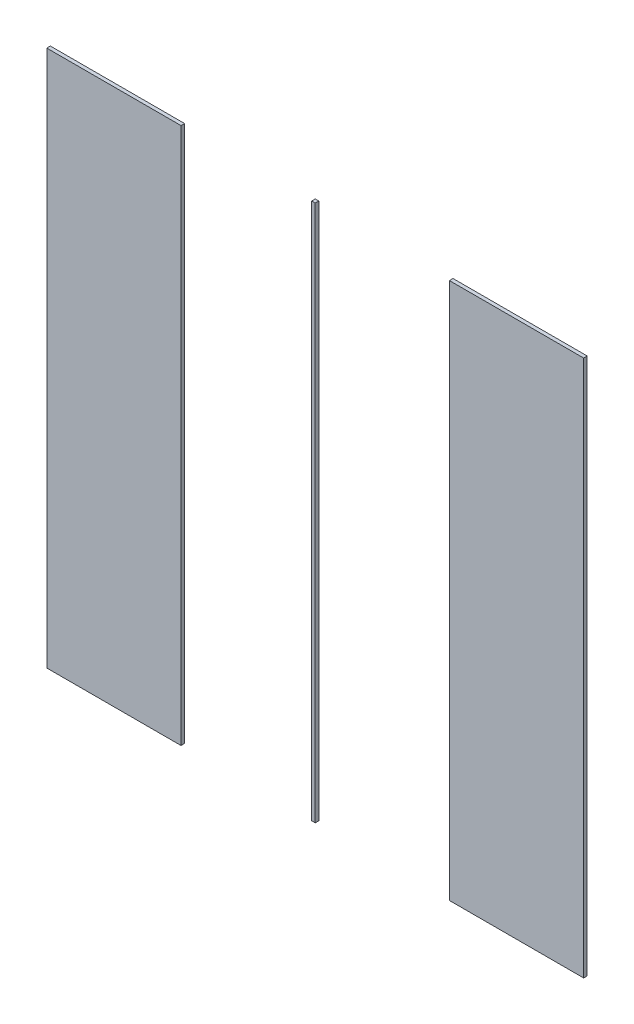
from build123d import *

# Parameters (mm, degrees)
SKETCH1_W             = 375
SKETCH1_H             = 1500
BOSS_EXTRUDE2_DEPTH   = 10
BOSS_EXTRUDE2_2_DEPTH = 10
SKETCH4_W             = 10
SKETCH4_H             = 1499.626705804
EXTRUDE_THIN4_DEPTH   = 10


with BuildPart() as part:
    # Sketch1 → Boss-Extrude2 (new body)
    with BuildSketch(Plane.XY):
        with Locations((-562.5, 0)):
            Rectangle(SKETCH1_W, SKETCH1_H)
    extrude(amount=BOSS_EXTRUDE2_DEPTH)


with BuildPart() as body_2:
    # Sketch1 → Boss-Extrude2 2 (new body)
    with BuildSketch(Plane.XY):
        with Locations((562.5, 0)):
            Rectangle(SKETCH1_W, SKETCH1_H)
    extrude(amount=BOSS_EXTRUDE2_2_DEPTH)


with BuildPart() as body_3:
    # Sketch4 → Extrude-Thin4 (new body)
    with BuildSketch(Plane.XY):
        with Locations((-5, 0.186647098)):
            Rectangle(SKETCH4_W, SKETCH4_H)
    extrude(amount=EXTRUDE_THIN4_DEPTH)


solid = Compound([part.part, body_2.part, body_3.part])
